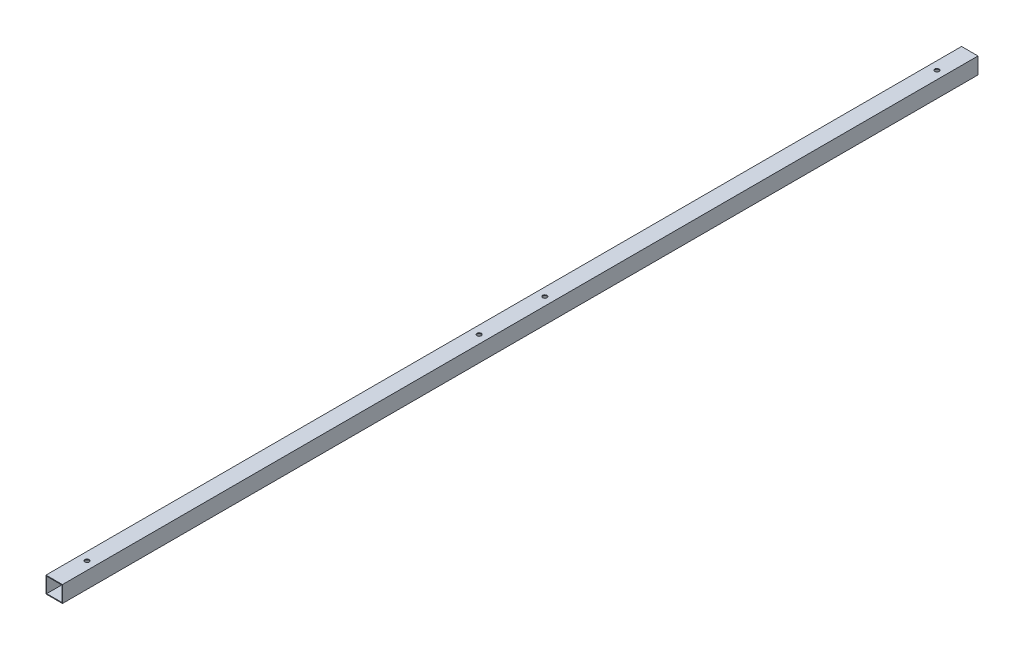
from build123d import *

# Parameters (mm, degrees)
SKETCH2_W                = 38.1
SKETCH2_H                = 38.1
SKETCH2_W_2              = 34.925
SKETCH2_H_2              = 34.925
BOSS_EXTRUDE1_DEPTH      = 2120.9
X_0_397_DIAMETER_HOLE1_D = 10.0838


with BuildPart() as part:
    # Sketch2 → Boss-Extrude1 (new body)
    with BuildSketch(Plane.XY):
        with Locations((19.05, 19.05)):
            Rectangle(SKETCH2_W, SKETCH2_H)
        with Locations((19.05, 19.05)):
            Rectangle(SKETCH2_W_2, SKETCH2_H_2, mode=Mode.SUBTRACT)
    extrude(amount=BOSS_EXTRUDE1_DEPTH)

    # X (0.397) Diameter Hole1 (through all)
    with Locations(Plane(origin=(0, 0, 0), x_dir=(-1, 0, 0), z_dir=(0, -1, 0))):
        with Locations((-19.05, -2044.7), (-19.05, -1136.65), (-19.05, -984.25), (-19.05, -76.2)):
            Hole(X_0_397_DIAMETER_HOLE1_D / 2)


solid = part.part
